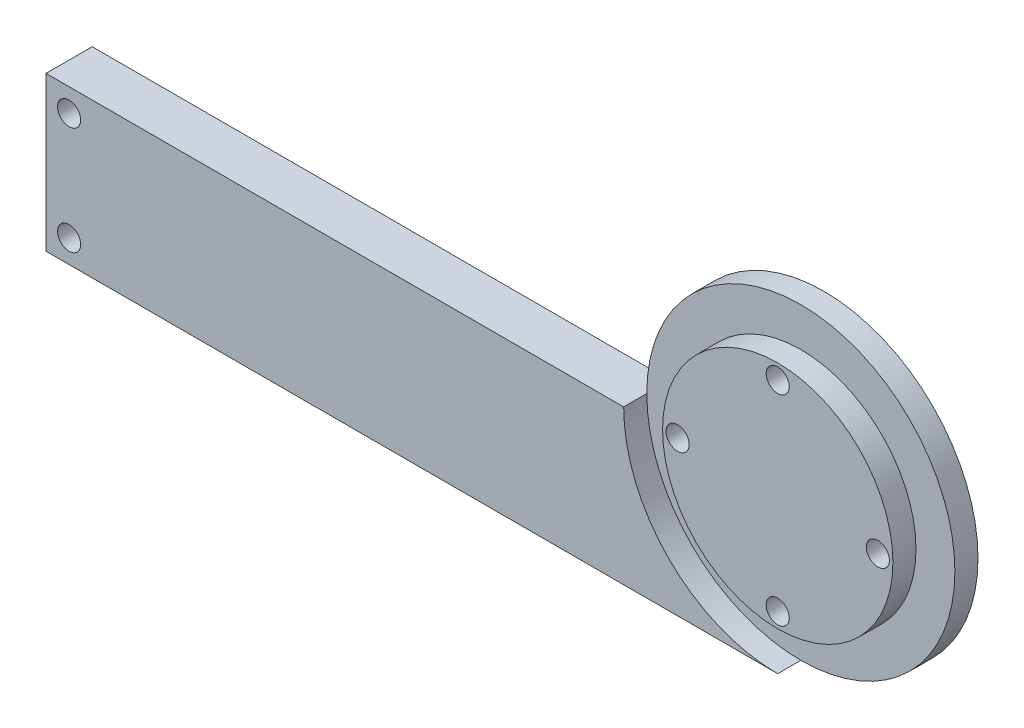
from build123d import *

# Parameters (mm, degrees)
BOSS_EXTRU_1_DEPTH      = 6
ENL_V_START             = -3
ESQUISSE4_R             = 20
ESQUISSE4_R_2           = 14.95
ENL_V_MAT_EXTRU_2_DEPTH = 3
ESQUISSE5_W             = 16.42
ESQUISSE5_H             = 20
BOSS_EXTRU_2_DEPTH      = 6
ESQUISSE6_R             = 1.5
ENL_V_MAT_EXTRU_3_DEPTH = 10
ESQUISSE9_R             = 1.5
ENL_V_MAT_EXTRU_4_DEPTH = 10


with BuildPart() as part:
    # Esquisse1 → Boss.-Extru.1 (new body)
    with BuildSketch(Plane.XY):
        with BuildLine():
            Line((12.992232765, 28.099272116), (-45.58279523, 28.099272116))
            Line((-45.58279523, 28.099272116), (-45.58279523, 8.099272116))
            Line((-45.58279523, 8.099272116), (32.992232765, 8.099272116))
            ThreePointArc((32.992232765, 8.099272116), (47.134368389, 42.24140774), (12.992232765, 28.099272116))
        make_face()
    extrude(amount=BOSS_EXTRU_1_DEPTH)

    # Esquisse4 → Enlèv. mat.-Extru.2 (cut)
    with BuildSketch(Plane.XY.offset(6).offset(ENL_V_START)):
        with Locations((32.992232765, 28.099272116)):
            Circle(ESQUISSE4_R)
        with Locations((32.992232765, 28.099272116)):
            Circle(ESQUISSE4_R_2, mode=Mode.SUBTRACT)
    extrude(amount=ENL_V_MAT_EXTRU_2_DEPTH, mode=Mode.SUBTRACT)

    # Esquisse5 → Boss.-Extru.2 (add)
    with BuildSketch(Plane.XY.offset(6)):
        with Locations((-53.79279523, 18.099272116)):
            Rectangle(ESQUISSE5_W, ESQUISSE5_H)
    extrude(amount=-BOSS_EXTRU_2_DEPTH)

    # Esquisse6 → Enlèv. mat.-Extru.3 (cut)
    with BuildSketch(Plane.XY.offset(6)):
        with Locations((32.992232765, 41.099272116)):
            Circle(ESQUISSE6_R)
        with Locations((45.992232765, 28.099272116)):
            Circle(ESQUISSE6_R)
        with Locations((32.992232765, 15.099272116)):
            Circle(ESQUISSE6_R)
        with Locations((19.992232765, 28.099272116)):
            Circle(ESQUISSE6_R)
    extrude(amount=-ENL_V_MAT_EXTRU_3_DEPTH, mode=Mode.SUBTRACT)

    # Esquisse9 → Enlèv. mat.-Extru.4 (cut)
    with BuildSketch(Plane(origin=(0, 0, 0), x_dir=(-1, 0, 0), z_dir=(0, 0, -1))):
        with Locations((59.00279523, 25.099272116)):
            Circle(ESQUISSE9_R)
        with Locations((59.00279523, 11.099272116)):
            Circle(ESQUISSE9_R)
    extrude(amount=-ENL_V_MAT_EXTRU_4_DEPTH, mode=Mode.SUBTRACT)


solid = part.part
